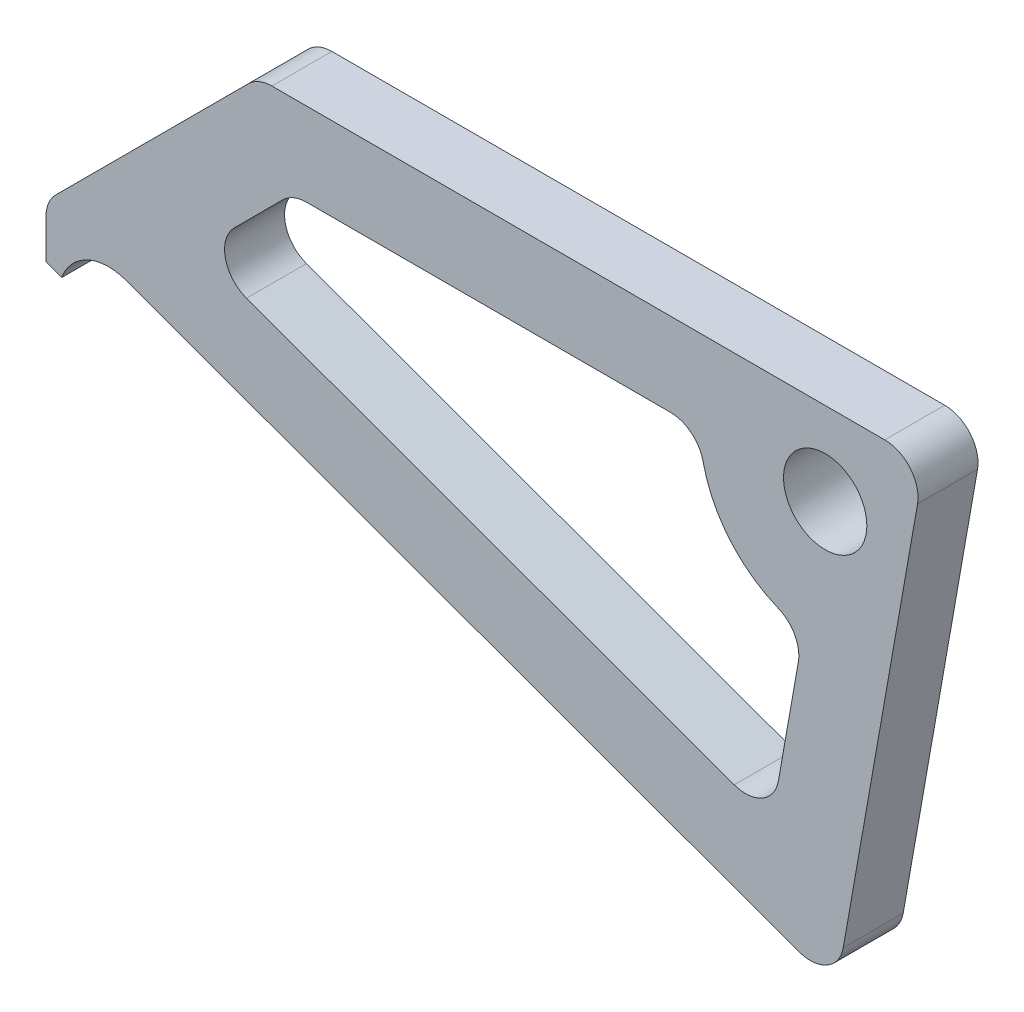
from build123d import *

# Parameters (mm, degrees)
SKETCH4_R           = 12.5
BOSS_EXTRUDE1_DEPTH = 18


with BuildPart() as part:
    # Sketch4 → Boss-Extrude1 (new body)
    with BuildSketch(Plane.XY):
        with BuildLine():
            Line((-263.661667122, -79.624333709), (-258.963204018, -81.334434426))
            ThreePointArc((-258.963204018, -81.334434426), (-251.207088632, -72.87011977), (-239.737512556, -72.369347264))
            Line((-239.737512556, -72.369347264), (-37.647867674, -145.923962655))
            ThreePointArc((-37.647867674, -145.923962655), (-29.227666241, -145.187290485), (-24.37958871, -138.263518223))
            Line((-24.37958871, -138.263518223), (-2.069458396, -11.736481777))
            ThreePointArc((-2.069458396, -11.736481777), (-4.257091495, -3.572123903), (-11.917535926, 0))
            Line((-11.917535926, 0), (-195.857864376, 0))
            ThreePointArc((-195.857864376, 0), (-199.6846987, -0.761204675), (-202.928932188, -2.928932188))
            Line((-202.928932188, -2.928932188), (-260.732734934, -60.732734934))
            ThreePointArc((-260.732734934, -60.732734934), (-262.900462447, -63.976968422), (-263.661667122, -67.803802746))
            Line((-263.661667122, -67.803802746), (-263.661667122, -79.624333709))
        make_face()
        with Locations((-29.793839815, -25)):
            Circle(SKETCH4_R, mode=Mode.SUBTRACT)
        with BuildLine():
            Line((-207.136261535, -42.491600595), (-192.573593129, -27.928932188))
            ThreePointArc((-192.573593129, -27.928932188), (-189.329359641, -25.761204675), (-185.502525317, -25))
            Line((-185.502525317, -25), (-76.229278867, -25))
            ThreePointArc((-76.229278867, -25), (-69.946470243, -27.220133948), (-66.453396962, -32.894736842))
            ThreePointArc((-66.453396962, -32.894736842), (-58.520506432, -49.104535363), (-43.934503158, -59.731709434))
            ThreePointArc((-43.934503158, -59.731709434), (-38.952676042, -64.157099535), (-37.857269185, -70.729980393))
            Line((-37.857269185, -70.729980393), (-43.826136546, -104.58110934))
            ThreePointArc((-43.826136546, -104.58110934), (-48.674214076, -111.504881601), (-57.09441551, -112.241553771))
            Line((-57.09441551, -112.241553771), (-203.485395157, -58.959594615))
            ThreePointArc((-203.485395157, -58.959594615), (-209.828153795, -51.727064546), (-207.136261535, -42.491600595))
        make_face(mode=Mode.SUBTRACT)
    extrude(amount=BOSS_EXTRUDE1_DEPTH)


solid = part.part
